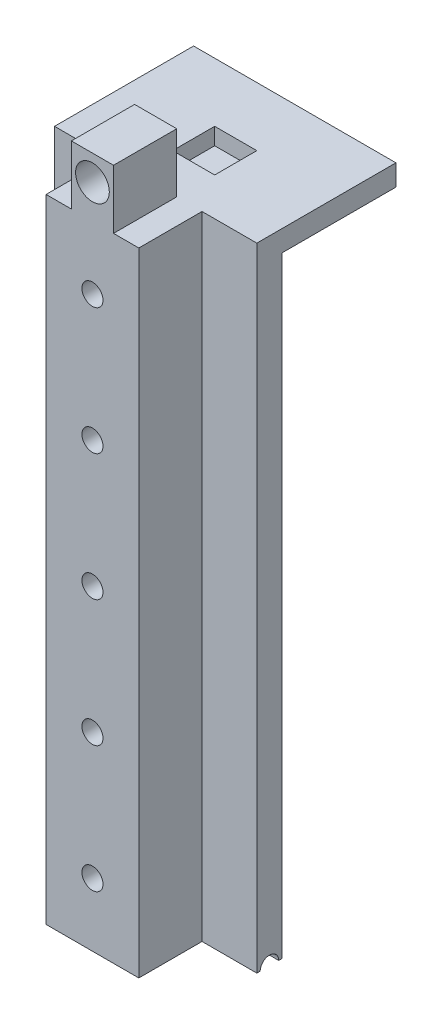
from build123d import *

# Parameters (mm, degrees)
SKETCH1_W                   = 24
SKETCH1_H                   = 75
BOSS_EXTRUDE1_DEPTH         = 3
SKETCH2_W                   = 11
SKETCH2_H                   = 75
BOSS_EXTRUDE2_DEPTH         = 7.5
TAP_DRILL_FOR_M3X0_5_TAP1_D = 2.5
SKETCH5_W                   = 7
SKETCH5_H                   = 72.5
CUT_EXTRUDE1_DEPTH          = 6
CUT_LOFT1_START             = 11.622950039
CUT_LOFT1_DEPTH             = 8.5
CUT_LOFT5_START             = 27.122950039
CUT_LOFT5_DEPTH             = 8.5
SKETCH16_W                  = 24
SKETCH16_H                  = 2.5
BOSS_EXTRUDE4_DEPTH         = 13.5
SKETCH17_W                  = 5
SKETCH17_H                  = 7.5
BOSS_EXTRUDE5_DEPTH         = 7
SKETCH18_R                  = 2
CUT_EXTRUDE2_DEPTH          = 7.5
SKETCH20_W                  = 5
SKETCH20_H                  = 5
CUT_EXTRUDE3_DEPTH          = 2


# Read off the part's stored shape, not the designer's step: Cut-Loft1, Cut-Loft5
with BuildPart() as part:
    # Sketch1 → Boss-Extrude1 (new body)
    with BuildSketch(Plane.XY):
        with Locations((23.622950039, -13.56022481)):
            Rectangle(SKETCH1_W, SKETCH1_H)
    extrude(amount=BOSS_EXTRUDE1_DEPTH)

    # Sketch2 → Boss-Extrude2 (add)
    with BuildSketch(Plane.XY.offset(3)):
        with Locations((23.622950039, -13.56022481)):
            Rectangle(SKETCH2_W, SKETCH2_H)
    extrude(amount=BOSS_EXTRUDE2_DEPTH)

    # Tap Drill for M3x0.5 Tap1 (through all)
    with Locations(Plane(origin=(23.622950039, 16.43977519, 10.5), x_dir=(1, 0, 0), z_dir=(0, 0, 1))):
        with Locations((0, 0), (0, -15), (0, -30), (0, -45), (0, -60)):
            Hole(TAP_DRILL_FOR_M3X0_5_TAP1_D / 2)

    # Sketch5 → Cut-Extrude1 (cut)
    with BuildSketch(Plane(origin=(0, 0, 0), x_dir=(-1, 0, 0), z_dir=(0, 0, -1))):
        with Locations((-23.622950039, -14.81022481)):
            Rectangle(SKETCH5_W, SKETCH5_H)
    extrude(amount=-CUT_EXTRUDE1_DEPTH, mode=Mode.SUBTRACT)

    # Cut-Loft1 outline → Cut-Loft1 (cut)
    with BuildSketch(Plane.YZ.offset(CUT_LOFT1_START)):
        with BuildLine():
            ThreePointArc((-51.06022481, 0.4), (-49.96022481, 1.5), (-51.06022481, 2.6))
            Line((-51.06022481, 2.6), (-51.06022481, 0.4))
        make_face()
    extrude(amount=CUT_LOFT1_DEPTH, mode=Mode.SUBTRACT)

    # Cut-Loft5 outline → Cut-Loft5 (cut)
    with BuildSketch(Plane.YZ.offset(CUT_LOFT5_START)):
        with BuildLine():
            Line((-51.06022481, 2.6), (-51.06022481, 0.4))
            ThreePointArc((-51.06022481, 0.4), (-49.96022481, 1.5), (-51.06022481, 2.6))
        make_face()
    extrude(amount=CUT_LOFT5_DEPTH, mode=Mode.SUBTRACT)

    # Sketch16 → Boss-Extrude4 (add)
    with BuildSketch(Plane(origin=(0, 0, 0), x_dir=(-1, 0, 0), z_dir=(0, 0, -1))):
        with Locations((-23.622950039, 22.68977519)):
            Rectangle(SKETCH16_W, SKETCH16_H)
    extrude(amount=BOSS_EXTRUDE4_DEPTH)

    # Sketch17 → Boss-Extrude5 (add)
    with BuildSketch(Plane(origin=(0, 23.93977519, 0), x_dir=(1, 0, 0), z_dir=(0, 1, 0))):
        with Locations((23.622950039, -6.75)):
            Rectangle(SKETCH17_W, SKETCH17_H)
    extrude(amount=BOSS_EXTRUDE5_DEPTH)

    # Sketch18 → Cut-Extrude2 (cut)
    with BuildSketch(Plane.XY.offset(10.5)):
        with Locations((23.622950039, 27.93977519)):
            Circle(SKETCH18_R)
    extrude(amount=-CUT_EXTRUDE2_DEPTH, mode=Mode.SUBTRACT)

    # Sketch20 → Cut-Extrude3 (cut)
    with BuildSketch(Plane(origin=(0, 23.93977519, 0), x_dir=(1, 0, 0), z_dir=(0, 1, 0))):
        with Locations((23.622950039, 4)):
            Rectangle(SKETCH20_W, SKETCH20_H)
    extrude(amount=-CUT_EXTRUDE3_DEPTH, mode=Mode.SUBTRACT)


solid = part.part
